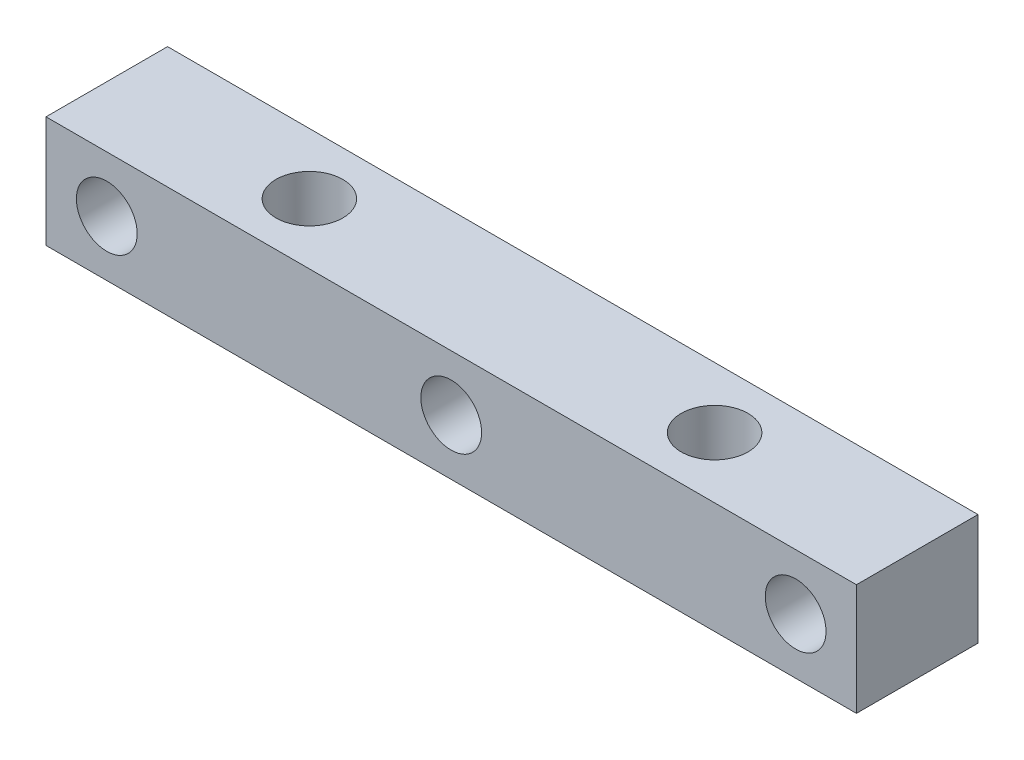
from build123d import *

# Parameters (mm, degrees)
ESQUISSE1_W                  = 40
ESQUISSE1_H                  = 5.5
BOSS_EXTRU_1_DEPTH           = 6
ENL_V_MAT_EXTRU_1_DEPTH      = 41.819725624
ENL_V_MAT_EXTRU_1_DEPTH_BACK = 41.819725624
ESQUISSE2_R                  = 1.5
ENL_V_MAT_EXTRU_2_DEPTH      = 41.819725624
ENL_V_MAT_EXTRU_2_DEPTH_BACK = 41.819725624
ESQUISSE3_R                  = 1.65


with BuildPart() as part:
    # Esquisse1 → Boss.-Extru.1 (new body)
    with BuildSketch(Plane.XY):
        with Locations((20, 2.75)):
            Rectangle(ESQUISSE1_W, ESQUISSE1_H)
    extrude(amount=BOSS_EXTRU_1_DEPTH)

    # Esquisse2 → Enlèv. mat.-Extru.1 (cut, two sides: drawn at the far end of the back side and taken through both)
    with BuildSketch(Plane.XY.offset(6).offset(-ENL_V_MAT_EXTRU_1_DEPTH_BACK)):
        with Locations((20, 2.75)):
            Circle(ESQUISSE2_R)
        with Locations((3, 2.75)):
            Circle(ESQUISSE2_R)
        with Locations((37, 2.75)):
            Circle(ESQUISSE2_R)
    extrude(amount=ENL_V_MAT_EXTRU_1_DEPTH + ENL_V_MAT_EXTRU_1_DEPTH_BACK, mode=Mode.SUBTRACT)

    # Esquisse3 → Enlèv. mat.-Extru.2 (cut, two sides: drawn at the far end of the back side and taken through both)
    with BuildSketch(Plane(origin=(0, 5.5, 0), x_dir=(1, 0, 0), z_dir=(0, 1, 0)).offset(-ENL_V_MAT_EXTRU_2_DEPTH_BACK)):
        with Locations((10, -3)):
            Circle(ESQUISSE3_R)
        with Locations((30, -3)):
            Circle(ESQUISSE3_R)
    extrude(amount=ENL_V_MAT_EXTRU_2_DEPTH + ENL_V_MAT_EXTRU_2_DEPTH_BACK, mode=Mode.SUBTRACT)


solid = part.part
